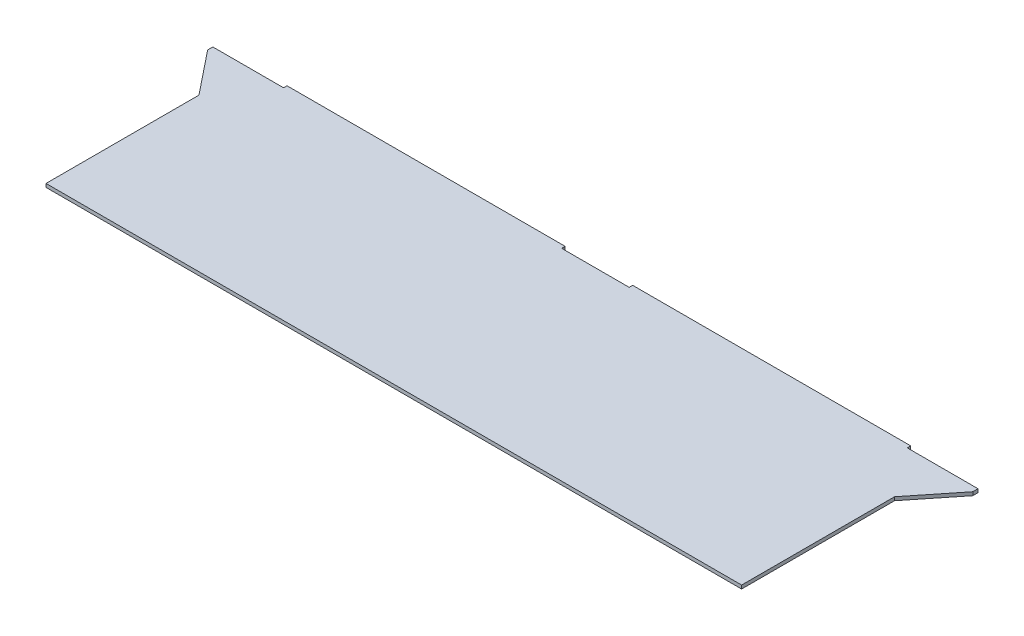
from build123d import *

# Parameters (mm, degrees)
SKETCH1_W           = 635.3556
SKETCH1_H           = 184.15
BOSS_EXTRUDE1_DEPTH = 1.5875
SKETCH2_W           = 254
SKETCH2_H           = 3.175
BOSS_EXTRUDE2_DEPTH = 3.175
BOSS_EXTRUDE3_DEPTH = 3.175


with BuildPart() as part:
    # Sketch1 → Boss-Extrude1 (new, symmetric)
    with BuildSketch(Plane(origin=(0, 0, 0), x_dir=(1, 0, 0), z_dir=(0, 1, 0))):
        Rectangle(SKETCH1_W, SKETCH1_H)
    extrude(amount=BOSS_EXTRUDE1_DEPTH, both=True)

    # Sketch2 → Boss-Extrude2 (add)
    with BuildSketch(Plane(origin=(0, 0, -92.075), x_dir=(-1, 0, 0), z_dir=(0, 0, -1))):
        with Locations((-157.8229, 0)):
            Rectangle(SKETCH2_W, SKETCH2_H)
        with Locations((157.8229, 0)):
            Rectangle(SKETCH2_W, SKETCH2_H)
    extrude(amount=BOSS_EXTRUDE2_DEPTH)

    # Sketch3 → Boss-Extrude3 (add)
    with BuildSketch(Plane.XZ.offset(1.5875)):
        Polygon((317.6778, -92.075), (349.4278, -92.075), (349.4278, -87.3125), (317.6778, -47.625), align=None)
    boss_extrude3 = extrude(amount=-BOSS_EXTRUDE3_DEPTH)

    # Mirror1: Boss-Extrude3 across plane
    add(boss_extrude3.mirror(Plane(origin=(0, 0, 0), x_dir=(0, 0, 1), z_dir=(1, 0, 0))))


solid = part.part
